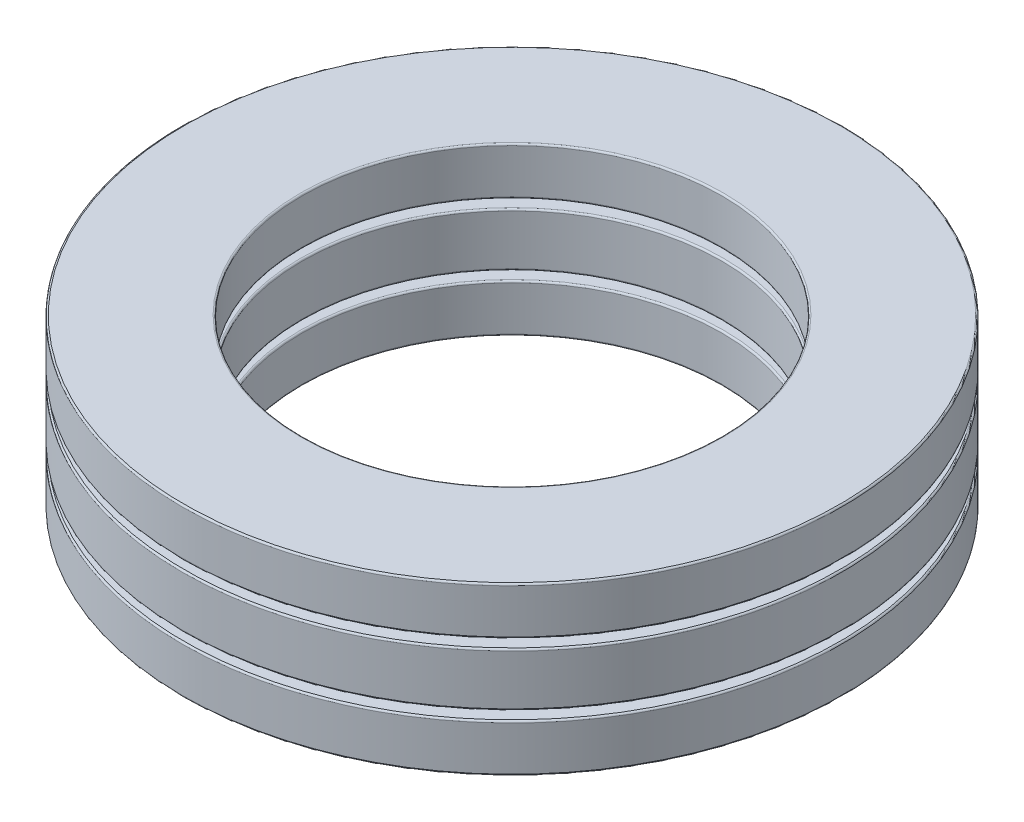
from build123d import *

# Parameters (mm, degrees)
SKETCH3_W         = 8
SKETCH3_H         = 3.5625
CIRPATTERN1_COUNT = 12
CIRPATTERN1_ANGLE = 330
CIRPATTERN2_COUNT = 12
SKETCH6_W         = 8
SKETCH6_H         = 3.18
FILLET1_R         = 0.1111
FILLET2_R         = 0.1111
FILLET3_R         = 0.1111


with BuildPart() as part:
    # Sketch3 → Revolve1 (revolve)
    with BuildSketch(Plane.XY):
        with Locations((18, 0)):
            Rectangle(SKETCH3_W, SKETCH3_H)
    revolve(axis=Axis((0, 5.555, 0), (0, -1, 0)))

    # Sketch4 → Cut-Revolve1 (revolve, cut)
    with BuildSketch(Plane.XY):
        with BuildLine():
            Line((18.25, 2.375), (18.25, -2.375))
            ThreePointArc((18.25, -2.375), (15.875, 0), (18.25, 2.375))
        make_face()
    cut_revolve1 = revolve(axis=Axis((18.25, 2.375, 0), (0, -1, 0)), mode=Mode.SUBTRACT)

    # CirPattern2: Cut-Revolve1 ×12 about axis
    cirpattern2_axis = Axis((0, 5.555, 0), (0, -1, 0))
    for i in range(1, CIRPATTERN2_COUNT):
        add(cut_revolve1.rotate(cirpattern2_axis, i * 360 / CIRPATTERN2_COUNT), mode=Mode.SUBTRACT)

    # Fillet2
    fillet2_edges = [part.edges().sort_by_distance(p)[0] for p in [
        (-14, -1.78125, 0),
        (-22, -1.78125, 0),
        (19.820914841, -1.78125, 0),
        (17.165415779, -1.78125, 9.91045742),
        (9.91045742, -1.78125, 17.165415779),
        (0, -1.78125, 19.820914841),
        (-9.91045742, -1.78125, 17.165415779),
        (-17.165415779, -1.78125, 9.91045742),
        (-19.820914841, -1.78125, 0),
        (-22, 1.78125, 0),
        (-14, 1.78125, 0),
        (19.820914841, 1.78125, 0),
        (17.165415779, 1.78125, 9.91045742),
        (9.91045742, 1.78125, 17.165415779),
        (0, 1.78125, 19.820914841),
        (-9.91045742, 1.78125, 17.165415779),
        (-17.165415779, 1.78125, 9.91045742),
        (-19.820914841, 1.78125, 0),
        (-17.165415779, -1.78125, -9.91045742),
        (-17.165415779, 1.78125, -9.91045742),
        (-9.91045742, -1.78125, -17.165415779),
        (0, -1.78125, -19.820914841),
        (9.91045742, -1.78125, -17.165415779),
        (17.165415779, -1.78125, -9.91045742),
        (-9.91045742, 1.78125, -17.165415779),
        (0, 1.78125, -19.820914841),
        (9.91045742, 1.78125, -17.165415779),
        (17.165415779, 1.78125, -9.91045742),
    ]]
    fillet(fillet2_edges, radius=FILLET2_R)


with BuildPart() as body_2:
    # Sketch5 → Revolve2 (revolve)
    with BuildSketch(Plane.XY):
        with BuildLine():
            Line((18.25, 2.375), (18.25, -2.375))
            ThreePointArc((18.25, -2.375), (15.875, 0), (18.25, 2.375))
        make_face()
    revolve(axis=Axis((18.25, 2.375, 0), (0, -1, 0)))


with BuildPart() as cirpattern1_1:
    # CirPattern1: pattern copy
    add(body_2.part.rotate(Axis((0, 5.555, 0), (0, -1, 0)), 1 * CIRPATTERN1_ANGLE / (CIRPATTERN1_COUNT - 1)))


with BuildPart() as cirpattern1_2:
    # CirPattern1: pattern copy
    add(body_2.part.rotate(Axis((0, 5.555, 0), (0, -1, 0)), 2 * CIRPATTERN1_ANGLE / (CIRPATTERN1_COUNT - 1)))


with BuildPart() as cirpattern1_3:
    # CirPattern1: pattern copy
    add(body_2.part.rotate(Axis((0, 5.555, 0), (0, -1, 0)), 3 * CIRPATTERN1_ANGLE / (CIRPATTERN1_COUNT - 1)))


with BuildPart() as cirpattern1_4:
    # CirPattern1: pattern copy
    add(body_2.part.rotate(Axis((0, 5.555, 0), (0, -1, 0)), 4 * CIRPATTERN1_ANGLE / (CIRPATTERN1_COUNT - 1)))


with BuildPart() as cirpattern1_5:
    # CirPattern1: pattern copy
    add(body_2.part.rotate(Axis((0, 5.555, 0), (0, -1, 0)), 5 * CIRPATTERN1_ANGLE / (CIRPATTERN1_COUNT - 1)))


with BuildPart() as cirpattern1_6:
    # CirPattern1: pattern copy
    add(body_2.part.rotate(Axis((0, 5.555, 0), (0, -1, 0)), 6 * CIRPATTERN1_ANGLE / (CIRPATTERN1_COUNT - 1)))


with BuildPart() as cirpattern1_7:
    # CirPattern1: pattern copy
    add(body_2.part.rotate(Axis((0, 5.555, 0), (0, -1, 0)), 7 * CIRPATTERN1_ANGLE / (CIRPATTERN1_COUNT - 1)))


with BuildPart() as cirpattern1_8:
    # CirPattern1: pattern copy
    add(body_2.part.rotate(Axis((0, 5.555, 0), (0, -1, 0)), 8 * CIRPATTERN1_ANGLE / (CIRPATTERN1_COUNT - 1)))


with BuildPart() as cirpattern1_9:
    # CirPattern1: pattern copy
    add(body_2.part.rotate(Axis((0, 5.555, 0), (0, -1, 0)), 9 * CIRPATTERN1_ANGLE / (CIRPATTERN1_COUNT - 1)))


with BuildPart() as cirpattern1_10:
    # CirPattern1: pattern copy
    add(body_2.part.rotate(Axis((0, 5.555, 0), (0, -1, 0)), 10 * CIRPATTERN1_ANGLE / (CIRPATTERN1_COUNT - 1)))


with BuildPart() as cirpattern1_11:
    # CirPattern1: pattern copy
    add(body_2.part.rotate(Axis((0, 5.555, 0), (0, -1, 0)), 11 * CIRPATTERN1_ANGLE / (CIRPATTERN1_COUNT - 1)))


with BuildPart() as body_14:
    # Sketch6 → Revolve3 (revolve)
    with BuildSketch(Plane.XY):
        with Locations((18, 3.965)):
            Rectangle(SKETCH6_W, SKETCH6_H)
        with Locations((18, -3.965)):
            Rectangle(SKETCH6_W, SKETCH6_H)
    revolve(axis=Axis((0, 5.555, 0), (0, -1, 0)))

    # Fillet1
    fillet1_edges = [body_14.edges().sort_by_distance(p)[0] for p in [
        (-14, 2.375, 0),
        (-22, 2.375, 0),
        (-22, 5.555, 0),
        (-14, 5.555, 0),
    ]]
    fillet(fillet1_edges, radius=FILLET1_R)

    # Fillet3
    fillet3_edges = [body_14.edges().sort_by_distance(p)[0] for p in [
        (-22, -2.375, 0),
        (-14, -2.375, 0),
        (-14, -5.555, 0),
        (-22, -5.555, 0),
    ]]
    fillet(fillet3_edges, radius=FILLET3_R)


solid = Compound([part.part, body_2.part, cirpattern1_1.part, cirpattern1_2.part, cirpattern1_3.part, cirpattern1_4.part, cirpattern1_5.part, cirpattern1_6.part, cirpattern1_7.part, cirpattern1_8.part, cirpattern1_9.part, cirpattern1_10.part, cirpattern1_11.part, body_14.part])
